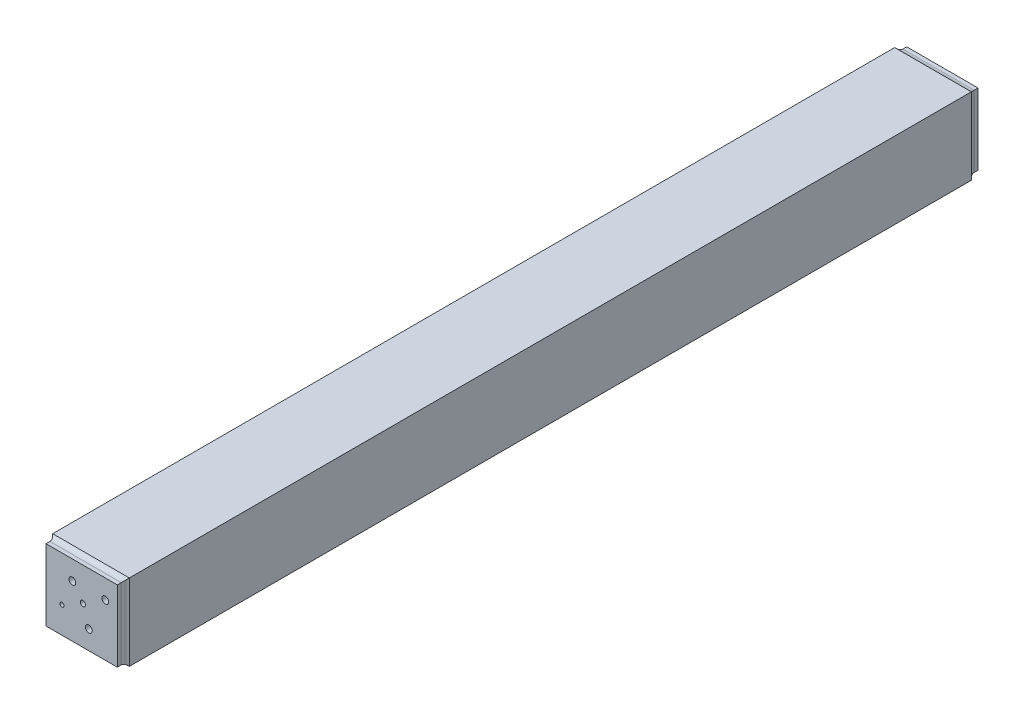
from build123d import *

# Parameters (mm, degrees)
SKETCH1_W           = 41.43
SKETCH1_H           = 41.43
SKETCH1_R           = 2
BOSS_EXTRUDE1_DEPTH = 5.42
SKETCH2_W           = 44.53
SKETCH2_H           = 44.53
SKETCH2_W_2         = 38.18
SKETCH2_H_2         = 38.18
BOSS_EXTRUDE2_DEPTH = 489.16
SKETCH3_W           = 41.43
SKETCH3_H           = 41.43
SKETCH3_R           = 2
SKETCH3_R_2         = 1.505
SKETCH3_R_3         = 1.2
BOSS_EXTRUDE3_DEPTH = 5.42
FILLET1_R           = 4


with BuildPart() as part:
    # Sketch1 → Boss-Extrude1 (new body)
    with BuildSketch(Plane.XY):
        with Locations((22.265, -22.265)):
            Rectangle(SKETCH1_W, SKETCH1_H)
        with Locations((12.93, -12.9)):
            Circle(SKETCH1_R, mode=Mode.SUBTRACT)
        with Locations((31.93, -12.9)):
            Circle(SKETCH1_R, mode=Mode.SUBTRACT)
    extrude(amount=-BOSS_EXTRUDE1_DEPTH)

    # Sketch2 → Boss-Extrude2 (add)
    with BuildSketch(Plane(origin=(0, 0, 0), x_dir=(-1, 0, 0), z_dir=(0, 0, -1))):
        with Locations((-22.265, -22.265)):
            Rectangle(SKETCH2_W, SKETCH2_H)
        with Locations((-22.265, -22.265)):
            Rectangle(SKETCH2_W_2, SKETCH2_H_2, mode=Mode.SUBTRACT)
    extrude(amount=-BOSS_EXTRUDE2_DEPTH)

    # Sketch3 → Boss-Extrude3 (add)
    with BuildSketch(Plane.XY.offset(489.16)):
        with Locations((22.265, -22.265)):
            Rectangle(SKETCH3_W, SKETCH3_H)
        with Locations((16.84, -12.675466776)):
            Circle(SKETCH3_R, mode=Mode.SUBTRACT)
        with Locations((36.01, -12.675466776)):
            Circle(SKETCH3_R, mode=Mode.SUBTRACT)
        with Locations((26.425, -32.01)):
            Circle(SKETCH3_R, mode=Mode.SUBTRACT)
        with Locations((22.97275137, -20.926955012)):
            Circle(SKETCH3_R_2, mode=Mode.SUBTRACT)
        with Locations((10.8715013, -27.565833881)):
            Circle(SKETCH3_R_3, mode=Mode.SUBTRACT)
    extrude(amount=BOSS_EXTRUDE3_DEPTH)

    # Fillet1
    # the kernel refuses this fillet: 4 mm, written as the material it adds along each edge
    with BuildSketch(Plane(origin=(1.55, -42.98, 0), x_dir=(0, -1, 0), z_dir=(1, 0, 0)), Plane(origin=(1.55, -42.98, 489.16), x_dir=(-1, 0, 0), z_dir=(0, 1, 0)), Plane(origin=(42.98, -42.98, 489.16), x_dir=(0, -1, 0), z_dir=(-1, 0, 0)), Plane(origin=(42.98, -1.55, 489.16), x_dir=(1, 0, 0), z_dir=(0, -1, 0)), Plane(origin=(1.55, -1.55, 489.16), x_dir=(0, 1, 0), z_dir=(1, 0, 0))) as fillet1_piece_1:
        with BuildLine():
            CenterArc((4, 3.161882351), FILLET1_R, 180, 52.229510411)
            Line((0, 3.161882351), (-0.08, 3.161882351))
            Line((-0.08, 3.161882351), (-0.08, 0))
            Line((-0.08, 0), (0, -0.08))
            ThreePointArc((0, -0.08), (0.775, -0.08), (1.501, -0.063237647))
            Line((1.501, -0.063237647), (1.55, 0))
        make_face()
    extrude(amount=41.43)
    with BuildSketch(Plane(origin=(1.55, -1.55, 0), x_dir=(0, 0, -1), z_dir=(0, -1, 0)), Plane(origin=(42.98, -1.55, 0), x_dir=(0, 0, -1), z_dir=(-1, 0, 0)), Plane(origin=(42.98, -42.98, 0), x_dir=(0, 0, -1), z_dir=(0, 1, 0))) as fillet1_piece_2:
        with BuildLine():
            CenterArc((3.161882351, -4), FILLET1_R, 90, 52.229510411)
            Line((0, -1.55), (-0.063237647, -1.501))
            ThreePointArc((-0.063237647, -1.501), (-0.08, -0.775), (-0.08, 0))
            Line((-0.08, 0), (0, 0.08))
            Line((0, 0.08), (3.161882351, 0.08))
            Line((3.161882351, 0.08), (3.161882351, 0))
        make_face()
    extrude(amount=41.43)
    with BuildSketch(Plane(origin=(1.55, -1.55, 0), x_dir=(0, 0, -1), z_dir=(0, -1, 0))) as fillet1_piece_3a_section:
        with BuildLine():
            CenterArc((3.161882351, -4), FILLET1_R, 90, 52.229510411)
            Line((0, -1.55), (-0.063237647, -1.501))
            ThreePointArc((-0.063237647, -1.501), (-0.08, -0.775), (-0.08, 0))
            Line((-0.08, 0), (0, 0.08))
            Line((0, 0.08), (3.161882351, 0.08))
            Line((3.161882351, 0.08), (3.161882351, 0))
        make_face()
    fillet1_piece_3a = extrude(amount=49.334705877, mode=Mode.PRIVATE)
    fillet1_piece_3a = split(fillet1_piece_3a, bisect_by=Plane(origin=(1.154343324, -42.98, -0.817162135), z_dir=(0, -1, 0)), keep=Keep.TOP, mode=Mode.PRIVATE)
    fillet1_piece_3a = split(fillet1_piece_3a, bisect_by=Plane(origin=(1.154343324, -44.53, -0.817162135), z_dir=(0, 1, 0)), keep=Keep.TOP, mode=Mode.PRIVATE)
    with BuildSketch(Plane(origin=(-6.354705877, -42.98, 0), x_dir=(0, -1, 0), z_dir=(1, 0, 0))) as fillet1_piece_3b_section:
        with BuildLine():
            CenterArc((4, 3.161882351), FILLET1_R, 180, 52.229510411)
            Line((0, 3.161882351), (-0.08, 3.161882351))
            Line((-0.08, 3.161882351), (-0.08, 0))
            Line((-0.08, 0), (0, -0.08))
            ThreePointArc((0, -0.08), (0.775, -0.08), (1.501, -0.063237647))
            Line((1.501, -0.063237647), (1.55, 0))
        make_face()
    fillet1_piece_3b = extrude(amount=49.334705877, mode=Mode.PRIVATE)
    fillet1_piece_3b = split(fillet1_piece_3b, bisect_by=Plane(origin=(1.55, -43.375656676, -0.817162135), z_dir=(-1, 0, 0)), keep=Keep.TOP, mode=Mode.PRIVATE)
    fillet1_piece_3b = split(fillet1_piece_3b, bisect_by=Plane(origin=(0, -43.375656676, -0.817162135), z_dir=(1, 0, 0)), keep=Keep.TOP, mode=Mode.PRIVATE)
    fillet1_piece_3 = fillet1_piece_3a & fillet1_piece_3b
    add(fillet1_piece_3)
    with BuildSketch(Plane(origin=(42.98, -50.884705877, 0), x_dir=(0, 0, -1), z_dir=(0, 1, 0))) as fillet1_piece_4a_section:
        with BuildLine():
            CenterArc((3.161882351, -4), FILLET1_R, 90, 52.229510411)
            Line((0, -1.55), (-0.063237647, -1.501))
            ThreePointArc((-0.063237647, -1.501), (-0.08, -0.775), (-0.08, 0))
            Line((-0.08, 0), (0, 0.08))
            Line((0, 0.08), (3.161882351, 0.08))
            Line((3.161882351, 0.08), (3.161882351, 0))
        make_face()
    fillet1_piece_4a = extrude(amount=49.334705877, mode=Mode.PRIVATE)
    fillet1_piece_4a = split(fillet1_piece_4a, bisect_by=Plane(origin=(43.375656676, -42.98, -0.817162135), z_dir=(0, -1, 0)), keep=Keep.TOP, mode=Mode.PRIVATE)
    fillet1_piece_4a = split(fillet1_piece_4a, bisect_by=Plane(origin=(43.375656676, -44.53, -0.817162135), z_dir=(0, 1, 0)), keep=Keep.TOP, mode=Mode.PRIVATE)
    with BuildSketch(Plane(origin=(1.55, -42.98, 0), x_dir=(0, -1, 0), z_dir=(1, 0, 0))) as fillet1_piece_4b_section:
        with BuildLine():
            CenterArc((4, 3.161882351), FILLET1_R, 180, 52.229510411)
            Line((0, 3.161882351), (-0.08, 3.161882351))
            Line((-0.08, 3.161882351), (-0.08, 0))
            Line((-0.08, 0), (0, -0.08))
            ThreePointArc((0, -0.08), (0.775, -0.08), (1.501, -0.063237647))
            Line((1.501, -0.063237647), (1.55, 0))
        make_face()
    fillet1_piece_4b = extrude(amount=49.334705877, mode=Mode.PRIVATE)
    fillet1_piece_4b = split(fillet1_piece_4b, bisect_by=Plane(origin=(42.98, -43.375656676, -0.817162135), z_dir=(1, 0, 0)), keep=Keep.TOP, mode=Mode.PRIVATE)
    fillet1_piece_4b = split(fillet1_piece_4b, bisect_by=Plane(origin=(44.53, -43.375656676, -0.817162135), z_dir=(-1, 0, 0)), keep=Keep.TOP, mode=Mode.PRIVATE)
    fillet1_piece_4 = fillet1_piece_4a & fillet1_piece_4b
    add(fillet1_piece_4)
    with BuildSketch(Plane(origin=(42.98, -1.55, 0), x_dir=(0, 0, -1), z_dir=(-1, 0, 0))) as fillet1_piece_5a_section:
        with BuildLine():
            CenterArc((3.161882351, -4), FILLET1_R, 90, 52.229510411)
            Line((0, -1.55), (-0.063237647, -1.501))
            ThreePointArc((-0.063237647, -1.501), (-0.08, -0.775), (-0.08, 0))
            Line((-0.08, 0), (0, 0.08))
            Line((0, 0.08), (3.161882351, 0.08))
            Line((3.161882351, 0.08), (3.161882351, 0))
        make_face()
    fillet1_piece_5a = extrude(amount=49.334705877, mode=Mode.PRIVATE)
    fillet1_piece_5a = split(fillet1_piece_5a, bisect_by=Plane(origin=(1.55, -1.154343324, -0.817162135), z_dir=(-1, 0, 0)), keep=Keep.TOP, mode=Mode.PRIVATE)
    fillet1_piece_5a = split(fillet1_piece_5a, bisect_by=Plane(origin=(0, -1.154343324, -0.817162135), z_dir=(1, 0, 0)), keep=Keep.TOP, mode=Mode.PRIVATE)
    with BuildSketch(Plane(origin=(1.55, 6.354705877, 0), x_dir=(0, 0, -1), z_dir=(0, -1, 0))) as fillet1_piece_5b_section:
        with BuildLine():
            CenterArc((3.161882351, -4), FILLET1_R, 90, 52.229510411)
            Line((0, -1.55), (-0.063237647, -1.501))
            ThreePointArc((-0.063237647, -1.501), (-0.08, -0.775), (-0.08, 0))
            Line((-0.08, 0), (0, 0.08))
            Line((0, 0.08), (3.161882351, 0.08))
            Line((3.161882351, 0.08), (3.161882351, 0))
        make_face()
    fillet1_piece_5b = extrude(amount=49.334705877, mode=Mode.PRIVATE)
    fillet1_piece_5b = split(fillet1_piece_5b, bisect_by=Plane(origin=(1.154343324, -1.55, -0.817162135), z_dir=(0, 1, 0)), keep=Keep.TOP, mode=Mode.PRIVATE)
    fillet1_piece_5b = split(fillet1_piece_5b, bisect_by=Plane(origin=(1.154343324, 0, -0.817162135), z_dir=(0, -1, 0)), keep=Keep.TOP, mode=Mode.PRIVATE)
    fillet1_piece_5 = fillet1_piece_5a & fillet1_piece_5b
    add(fillet1_piece_5)
    with BuildSketch(Plane(origin=(42.98, -42.98, 489.16), x_dir=(0, -1, 0), z_dir=(-1, 0, 0))) as fillet1_piece_6a_section:
        with BuildLine():
            CenterArc((4, 3.161882351), FILLET1_R, 180, 52.229510411)
            Line((0, 3.161882351), (-0.08, 3.161882351))
            Line((-0.08, 3.161882351), (-0.08, 0))
            Line((-0.08, 0), (0, -0.08))
            ThreePointArc((0, -0.08), (0.775, -0.08), (1.501, -0.063237647))
            Line((1.501, -0.063237647), (1.55, 0))
        make_face()
    fillet1_piece_6a = extrude(amount=49.334705877, mode=Mode.PRIVATE)
    fillet1_piece_6a = split(fillet1_piece_6a, bisect_by=Plane(origin=(0, -43.375656676, 489.977162135), z_dir=(1, 0, 0)), keep=Keep.TOP, mode=Mode.PRIVATE)
    fillet1_piece_6a = split(fillet1_piece_6a, bisect_by=Plane(origin=(1.55, -43.375656676, 489.977162135), z_dir=(-1, 0, 0)), keep=Keep.TOP, mode=Mode.PRIVATE)
    with BuildSketch(Plane(origin=(1.55, -50.884705877, 489.16), x_dir=(-1, 0, 0), z_dir=(0, 1, 0))) as fillet1_piece_6b_section:
        with BuildLine():
            CenterArc((4, 3.161882351), FILLET1_R, 180, 52.229510411)
            Line((0, 3.161882351), (-0.08, 3.161882351))
            Line((-0.08, 3.161882351), (-0.08, 0))
            Line((-0.08, 0), (0, -0.08))
            ThreePointArc((0, -0.08), (0.775, -0.08), (1.501, -0.063237647))
            Line((1.501, -0.063237647), (1.55, 0))
        make_face()
    fillet1_piece_6b = extrude(amount=49.334705877, mode=Mode.PRIVATE)
    fillet1_piece_6b = split(fillet1_piece_6b, bisect_by=Plane(origin=(1.154343324, -44.53, 489.977162135), z_dir=(0, 1, 0)), keep=Keep.TOP, mode=Mode.PRIVATE)
    fillet1_piece_6b = split(fillet1_piece_6b, bisect_by=Plane(origin=(1.154343324, -42.98, 489.977162135), z_dir=(0, -1, 0)), keep=Keep.TOP, mode=Mode.PRIVATE)
    fillet1_piece_6 = fillet1_piece_6a & fillet1_piece_6b
    add(fillet1_piece_6)
    with BuildSketch(Plane(origin=(-6.354705877, -1.55, 489.16), x_dir=(0, 1, 0), z_dir=(1, 0, 0))) as fillet1_piece_7a_section:
        with BuildLine():
            CenterArc((4, 3.161882351), FILLET1_R, 180, 52.229510411)
            Line((0, 3.161882351), (-0.08, 3.161882351))
            Line((-0.08, 3.161882351), (-0.08, 0))
            Line((-0.08, 0), (0, -0.08))
            ThreePointArc((0, -0.08), (0.775, -0.08), (1.501, -0.063237647))
            Line((1.501, -0.063237647), (1.55, 0))
        make_face()
    fillet1_piece_7a = extrude(amount=49.334705877, mode=Mode.PRIVATE)
    fillet1_piece_7a = split(fillet1_piece_7a, bisect_by=Plane(origin=(0, -1.154343324, 489.977162135), z_dir=(1, 0, 0)), keep=Keep.TOP, mode=Mode.PRIVATE)
    fillet1_piece_7a = split(fillet1_piece_7a, bisect_by=Plane(origin=(1.55, -1.154343324, 489.977162135), z_dir=(-1, 0, 0)), keep=Keep.TOP, mode=Mode.PRIVATE)
    with BuildSketch(Plane(origin=(1.55, -42.98, 489.16), x_dir=(-1, 0, 0), z_dir=(0, 1, 0))) as fillet1_piece_7b_section:
        with BuildLine():
            CenterArc((4, 3.161882351), FILLET1_R, 180, 52.229510411)
            Line((0, 3.161882351), (-0.08, 3.161882351))
            Line((-0.08, 3.161882351), (-0.08, 0))
            Line((-0.08, 0), (0, -0.08))
            ThreePointArc((0, -0.08), (0.775, -0.08), (1.501, -0.063237647))
            Line((1.501, -0.063237647), (1.55, 0))
        make_face()
    fillet1_piece_7b = extrude(amount=49.334705877, mode=Mode.PRIVATE)
    fillet1_piece_7b = split(fillet1_piece_7b, bisect_by=Plane(origin=(1.154343324, 0, 489.977162135), z_dir=(0, -1, 0)), keep=Keep.TOP, mode=Mode.PRIVATE)
    fillet1_piece_7b = split(fillet1_piece_7b, bisect_by=Plane(origin=(1.154343324, -1.55, 489.977162135), z_dir=(0, 1, 0)), keep=Keep.TOP, mode=Mode.PRIVATE)
    fillet1_piece_7 = fillet1_piece_7a & fillet1_piece_7b
    add(fillet1_piece_7)
    with BuildSketch(Plane(origin=(42.98, -1.55, 489.16), x_dir=(1, 0, 0), z_dir=(0, -1, 0))) as fillet1_piece_8a_section:
        with BuildLine():
            CenterArc((4, 3.161882351), FILLET1_R, 180, 52.229510411)
            Line((0, 3.161882351), (-0.08, 3.161882351))
            Line((-0.08, 3.161882351), (-0.08, 0))
            Line((-0.08, 0), (0, -0.08))
            ThreePointArc((0, -0.08), (0.775, -0.08), (1.501, -0.063237647))
            Line((1.501, -0.063237647), (1.55, 0))
        make_face()
    fillet1_piece_8a = extrude(amount=49.334705877, mode=Mode.PRIVATE)
    fillet1_piece_8a = split(fillet1_piece_8a, bisect_by=Plane(origin=(43.375656676, -44.53, 489.977162135), z_dir=(0, 1, 0)), keep=Keep.TOP, mode=Mode.PRIVATE)
    fillet1_piece_8a = split(fillet1_piece_8a, bisect_by=Plane(origin=(43.375656676, -42.98, 489.977162135), z_dir=(0, -1, 0)), keep=Keep.TOP, mode=Mode.PRIVATE)
    with BuildSketch(Plane(origin=(50.884705877, -42.98, 489.16), x_dir=(0, -1, 0), z_dir=(-1, 0, 0))) as fillet1_piece_8b_section:
        with BuildLine():
            CenterArc((4, 3.161882351), FILLET1_R, 180, 52.229510411)
            Line((0, 3.161882351), (-0.08, 3.161882351))
            Line((-0.08, 3.161882351), (-0.08, 0))
            Line((-0.08, 0), (0, -0.08))
            ThreePointArc((0, -0.08), (0.775, -0.08), (1.501, -0.063237647))
            Line((1.501, -0.063237647), (1.55, 0))
        make_face()
    fillet1_piece_8b = extrude(amount=49.334705877, mode=Mode.PRIVATE)
    fillet1_piece_8b = split(fillet1_piece_8b, bisect_by=Plane(origin=(44.53, -43.375656676, 489.977162135), z_dir=(-1, 0, 0)), keep=Keep.TOP, mode=Mode.PRIVATE)
    fillet1_piece_8b = split(fillet1_piece_8b, bisect_by=Plane(origin=(42.98, -43.375656676, 489.977162135), z_dir=(1, 0, 0)), keep=Keep.TOP, mode=Mode.PRIVATE)
    fillet1_piece_8 = fillet1_piece_8a & fillet1_piece_8b
    add(fillet1_piece_8)
    with BuildSketch(Plane(origin=(1.55, -1.55, 489.16), x_dir=(0, 1, 0), z_dir=(1, 0, 0))) as fillet1_piece_9a_section:
        with BuildLine():
            CenterArc((4, 3.161882351), FILLET1_R, 180, 52.229510411)
            Line((0, 3.161882351), (-0.08, 3.161882351))
            Line((-0.08, 3.161882351), (-0.08, 0))
            Line((-0.08, 0), (0, -0.08))
            ThreePointArc((0, -0.08), (0.775, -0.08), (1.501, -0.063237647))
            Line((1.501, -0.063237647), (1.55, 0))
        make_face()
    fillet1_piece_9a = extrude(amount=49.334705877, mode=Mode.PRIVATE)
    fillet1_piece_9a = split(fillet1_piece_9a, bisect_by=Plane(origin=(44.53, -1.154343324, 489.977162135), z_dir=(-1, 0, 0)), keep=Keep.TOP, mode=Mode.PRIVATE)
    fillet1_piece_9a = split(fillet1_piece_9a, bisect_by=Plane(origin=(42.98, -1.154343324, 489.977162135), z_dir=(1, 0, 0)), keep=Keep.TOP, mode=Mode.PRIVATE)
    with BuildSketch(Plane(origin=(42.98, 6.354705877, 489.16), x_dir=(1, 0, 0), z_dir=(0, -1, 0))) as fillet1_piece_9b_section:
        with BuildLine():
            CenterArc((4, 3.161882351), FILLET1_R, 180, 52.229510411)
            Line((0, 3.161882351), (-0.08, 3.161882351))
            Line((-0.08, 3.161882351), (-0.08, 0))
            Line((-0.08, 0), (0, -0.08))
            ThreePointArc((0, -0.08), (0.775, -0.08), (1.501, -0.063237647))
            Line((1.501, -0.063237647), (1.55, 0))
        make_face()
    fillet1_piece_9b = extrude(amount=49.334705877, mode=Mode.PRIVATE)
    fillet1_piece_9b = split(fillet1_piece_9b, bisect_by=Plane(origin=(43.375656676, 0, 489.977162135), z_dir=(0, -1, 0)), keep=Keep.TOP, mode=Mode.PRIVATE)
    fillet1_piece_9b = split(fillet1_piece_9b, bisect_by=Plane(origin=(43.375656676, -1.55, 489.977162135), z_dir=(0, 1, 0)), keep=Keep.TOP, mode=Mode.PRIVATE)
    fillet1_piece_9 = fillet1_piece_9a & fillet1_piece_9b
    add(fillet1_piece_9)
    with BuildSketch(Plane(origin=(50.884705877, -1.55, 0), x_dir=(0, 0, -1), z_dir=(-1, 0, 0))) as fillet1_piece_10a_section:
        with BuildLine():
            CenterArc((3.161882351, -4), FILLET1_R, 90, 52.229510411)
            Line((0, -1.55), (-0.063237647, -1.501))
            ThreePointArc((-0.063237647, -1.501), (-0.08, -0.775), (-0.08, 0))
            Line((-0.08, 0), (0, 0.08))
            Line((0, 0.08), (3.161882351, 0.08))
            Line((3.161882351, 0.08), (3.161882351, 0))
        make_face()
    fillet1_piece_10a = extrude(amount=49.334705877, mode=Mode.PRIVATE)
    fillet1_piece_10a = split(fillet1_piece_10a, bisect_by=Plane(origin=(42.98, -1.154343324, -0.817162135), z_dir=(1, 0, 0)), keep=Keep.TOP, mode=Mode.PRIVATE)
    fillet1_piece_10a = split(fillet1_piece_10a, bisect_by=Plane(origin=(44.53, -1.154343324, -0.817162135), z_dir=(-1, 0, 0)), keep=Keep.TOP, mode=Mode.PRIVATE)
    with BuildSketch(Plane(origin=(42.98, -42.98, 0), x_dir=(0, 0, -1), z_dir=(0, 1, 0))) as fillet1_piece_10b_section:
        with BuildLine():
            CenterArc((3.161882351, -4), FILLET1_R, 90, 52.229510411)
            Line((0, -1.55), (-0.063237647, -1.501))
            ThreePointArc((-0.063237647, -1.501), (-0.08, -0.775), (-0.08, 0))
            Line((-0.08, 0), (0, 0.08))
            Line((0, 0.08), (3.161882351, 0.08))
            Line((3.161882351, 0.08), (3.161882351, 0))
        make_face()
    fillet1_piece_10b = extrude(amount=49.334705877, mode=Mode.PRIVATE)
    fillet1_piece_10b = split(fillet1_piece_10b, bisect_by=Plane(origin=(43.375656676, -1.55, -0.817162135), z_dir=(0, 1, 0)), keep=Keep.TOP, mode=Mode.PRIVATE)
    fillet1_piece_10b = split(fillet1_piece_10b, bisect_by=Plane(origin=(43.375656676, 0, -0.817162135), z_dir=(0, -1, 0)), keep=Keep.TOP, mode=Mode.PRIVATE)
    fillet1_piece_10 = fillet1_piece_10a & fillet1_piece_10b
    add(fillet1_piece_10)


solid = part.part
